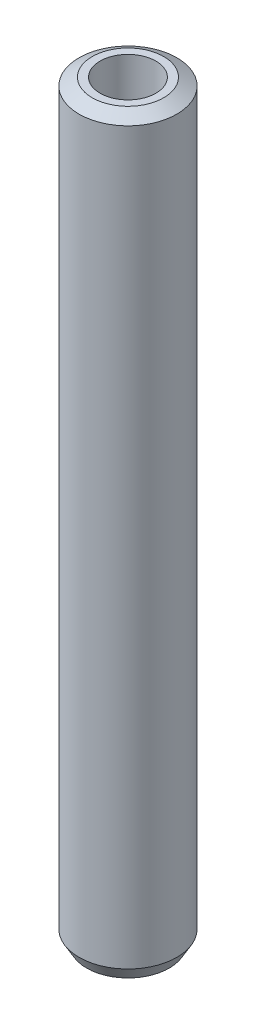
from build123d import *
from OCP.BRepFilletAPI import BRepFilletAPI_MakeChamfer

# Parameters (mm, degrees)
SKETCH1_R           = 35
BOSS_EXTRUDE1_DEPTH = 537.425727068
SKETCH2_R           = 19.969098576
CUT_EXTRUDE1_DEPTH  = 540.70029842
CHAMFER1_SIZE       = 5.442457949
CHAMFER1_SIZE2      = 9.426613685


with BuildPart() as part:
    # Sketch1 → Boss-Extrude1 (new body)
    with BuildSketch(Plane(origin=(0, 0, 0), x_dir=(1, 0, 0), z_dir=(0, 1, 0))):
        Circle(SKETCH1_R)
    extrude(amount=BOSS_EXTRUDE1_DEPTH)

    # Sketch2 → Cut-Extrude1 (cut, through all)
    with BuildSketch(Plane(origin=(0, 0, 0), x_dir=(1, 0, 0), z_dir=(0, 1, 0))):
        Circle(SKETCH2_R)
    extrude(amount=CUT_EXTRUDE1_DEPTH, mode=Mode.SUBTRACT)

    # Chamfer1: one chamfer whose edges measure the first distance from different faces: ONE call of the kernel's chamfer builder (chamfer() names one face for all edges)
    chamfer1_edges_1 = [part.edges().sort_by_distance(p)[0] for p in [
        (-35, 537.425727068, 0),
    ]]
    chamfer1_side_1 = [part.faces().sort_by_distance(p)[0] for p in [
        (-35, 268.712863534, 0),
    ]]
    chamfer1_edges_2 = [part.edges().sort_by_distance(p)[0] for p in [
        (-35, 0, 0),
    ]]
    chamfer1_side_2 = [part.faces().sort_by_distance(p)[0] for p in [
        (-34.010050506, 0, 0),
    ]]
    chamfer1 = BRepFilletAPI_MakeChamfer(part.part.solid().wrapped)
    for e in chamfer1_edges_1:
        chamfer1.Add(CHAMFER1_SIZE, CHAMFER1_SIZE2, e.wrapped, chamfer1_side_1[0].wrapped)  # the first distance lies on this face
    for e in chamfer1_edges_2:
        chamfer1.Add(CHAMFER1_SIZE, CHAMFER1_SIZE2, e.wrapped, chamfer1_side_2[0].wrapped)  # the first distance lies on this face
    add(Compound.cast(chamfer1.Shape()), mode=Mode.REPLACE)


solid = part.part
